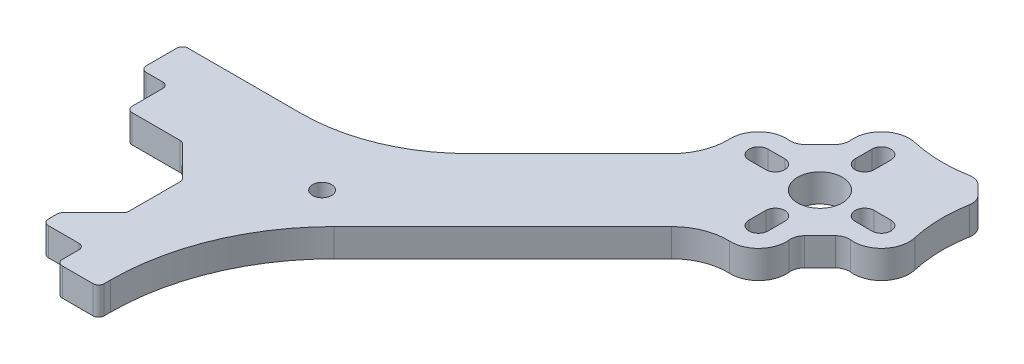
from build123d import *

# Parameters (mm, degrees)
SKETCH1_R            = 4
BOSS_EXTRUDE1_DEPTH  = 2.5
CUT_EXTRUDE1_DEPTH   = 10
FILLET1_R            = 2.5
FILLET2_R            = 1
M3_CLEARANCE_HOLE1_D = 3.4


with BuildPart() as part:
    # Sketch1 → Boss-Extrude1 (new, symmetric)
    with BuildSketch(Plane(origin=(0, 0, 0), x_dir=(1, 0, 0), z_dir=(0, 1, 0))):
        with BuildLine():
            Line((0, 45), (0, 37.5))
            Line((0, 37.5), (5, 37.5))
            Line((5, 37.5), (5, 30))
            Line((5, 30), (15, 30))
            Line((15, 30), (15, 5))
            Line((15, 5), (22.5, 5))
            Line((22.5, 5), (22.5, 0))
            Line((22.5, 0), (30, 0))
            Line((30, 0), (30, 2.117749006))
            ThreePointArc((30, 2.117749006), (33.0448187, 17.425086301), (41.715728753, 30.402020254))
            Line((41.715728753, 30.402020254), (71.943819698, 60.630111199))
            ThreePointArc((71.943819698, 60.630111199), (75.353330401, 62.864579349), (79.371304426, 63.552689718))
            ThreePointArc((79.371304426, 63.552689718), (83.204452196, 65.137560566), (84.522294498, 69.070514812))
            ThreePointArc((84.522294498, 69.070514812), (84.652219255, 70.16592161), (85.240918353, 71.098782729))
            Line((85.240918353, 71.098782729), (88.000243038, 73.858107414))
            ThreePointArc((88.000243038, 73.858107414), (88.933104157, 74.446806512), (90.028510955, 74.576731268))
            ThreePointArc((90.028510955, 74.576731268), (94.29022854, 76.231825981), (95.424472129, 80.660715996))
            ThreePointArc((95.424472129, 80.660715996), (94.799388668, 86.294292266), (95.45941546, 91.923881554))
            Line((95.45941546, 91.923881554), (91.923881554, 95.45941546))
            ThreePointArc((91.923881554, 95.45941546), (86.294292266, 94.799388668), (80.660715996, 95.424472129))
            ThreePointArc((80.660715996, 95.424472129), (76.231825981, 94.29022854), (74.576731268, 90.028510955))
            ThreePointArc((74.576731268, 90.028510955), (74.446806512, 88.933104157), (73.858107414, 88.000243038))
            Line((73.858107414, 88.000243038), (71.098782729, 85.240918353))
            ThreePointArc((71.098782729, 85.240918353), (70.16592161, 84.652219255), (69.070514812, 84.522294498))
            ThreePointArc((69.070514812, 84.522294498), (65.137560566, 83.204452196), (63.552689718, 79.371304426))
            ThreePointArc((63.552689718, 79.371304426), (62.864579349, 75.353330401), (60.630111199, 71.943819698))
            Line((60.630111199, 71.943819698), (42.473088065, 53.786796564))
            ThreePointArc((42.473088065, 53.786796564), (32.740387601, 47.283614025), (21.25988463, 45))
            Line((21.25988463, 45), (0, 45))
        make_face()
        with BuildLine():
            ThreePointArc((77.849512883, 71.549512883), (79.549512883, 73.249512883), (81.249512883, 71.549512883))
            Line((81.249512883, 71.549512883), (81.249512883, 68.549512883))
            ThreePointArc((81.249512883, 68.549512883), (79.549512883, 66.849512883), (77.849512883, 68.549512883))
            Line((77.849512883, 68.549512883), (77.849512883, 71.549512883))
        make_face(mode=Mode.SUBTRACT)
        with BuildLine():
            ThreePointArc((71.549512883, 81.249512883), (73.249512883, 79.549512883), (71.549512883, 77.849512883))
            Line((71.549512883, 77.849512883), (68.549512883, 77.849512883))
            ThreePointArc((68.549512883, 77.849512883), (66.849512883, 79.549512883), (68.549512883, 81.249512883))
            Line((68.549512883, 81.249512883), (71.549512883, 81.249512883))
        make_face(mode=Mode.SUBTRACT)
        with Locations((79.549512883, 79.549512883)):
            Circle(SKETCH1_R, mode=Mode.SUBTRACT)
        with BuildLine():
            ThreePointArc((87.549512883, 77.849512883), (85.849512883, 79.549512883), (87.549512883, 81.249512883))
            Line((87.549512883, 81.249512883), (90.549512883, 81.249512883))
            ThreePointArc((90.549512883, 81.249512883), (92.249512883, 79.549512883), (90.549512883, 77.849512883))
            Line((90.549512883, 77.849512883), (87.549512883, 77.849512883))
        make_face(mode=Mode.SUBTRACT)
        with BuildLine():
            ThreePointArc((81.249512883, 87.549512883), (79.549512883, 85.849512883), (77.849512883, 87.549512883))
            Line((77.849512883, 87.549512883), (77.849512883, 90.549512883))
            ThreePointArc((77.849512883, 90.549512883), (79.549512883, 92.249512883), (81.249512883, 90.549512883))
            Line((81.249512883, 90.549512883), (81.249512883, 87.549512883))
        make_face(mode=Mode.SUBTRACT)
    extrude(amount=BOSS_EXTRUDE1_DEPTH, both=True)

    # Sketch2 → Cut-Extrude1 (cut)
    with BuildSketch(Plane(origin=(0, 2.5, 0), x_dir=(1, 0, 0), z_dir=(0, 1, 0))):
        Polygon((21, 24), (15, 30), (15, 8), (21, 14), align=None)
    extrude(amount=-CUT_EXTRUDE1_DEPTH, mode=Mode.SUBTRACT)

    # Fillet1
    fillet1_edges = [part.edges().sort_by_distance(p)[0] for p in [
        (95.45941546, 0, -91.923881554),
        (91.923881554, 0, -95.45941546),
    ]]
    fillet(fillet1_edges, radius=FILLET1_R)

    # Fillet2
    fillet2_edges = [part.edges().sort_by_distance(p)[0] for p in [
        (22.5, 0, 0),
        (22.5, 0, -5),
        (15, 0, -5),
        (5, 0, -30),
        (5, 0, -37.5),
        (30, 0, 0),
        (0, 0, -45),
        (0, 0, -37.5),
        (15, 0, -8),
        (21, 0, -14),
        (21, 0, -24),
        (15, 0, -30),
    ]]
    fillet(fillet2_edges, radius=FILLET2_R)

    # M3 Clearance Hole1 (through all)
    with Locations(Plane(origin=(0, 2.5, 0), x_dir=(1, 0, 0), z_dir=(0, 1, 0))):
        with Locations((35, 35)):
            Hole(M3_CLEARANCE_HOLE1_D / 2)


solid = part.part
